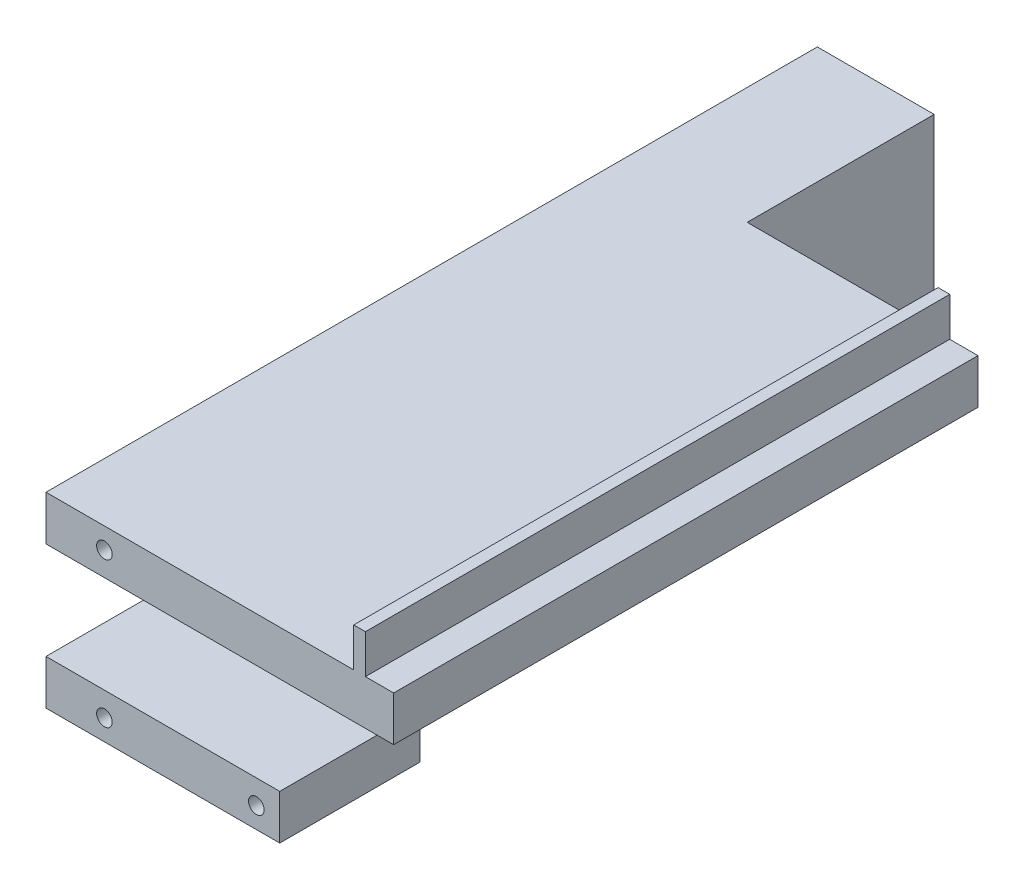
from build123d import *

# Parameters (mm, degrees)
CROQUIS1_W              = 60
CROQUIS1_H              = 48
SALIENTE_EXTRUIR1_DEPTH = 6
CROQUIS4_W              = 60
CROQUIS4_H              = 11.5
SALIENTE_EXTRUIR3_DEPTH = 30
CROQUIS5_R              = 2
CORTAR_EXTRUIR3_DEPTH   = 16
CROQUIS6_W              = 30
CROQUIS6_H              = 48
SALIENTE_EXTRUIR4_DEPTH = 162
CROQUIS7_R              = 2
CORTAR_EXTRUIR4_DEPTH   = 16
CROQUIS11_W             = 150
CROQUIS11_H             = 11.5
SALIENTE_EXTRUIR6_DEPTH = 59.25
CROQUIS12_W             = 3
CROQUIS12_H             = 150
SALIENTE_EXTRUIR7_DEPTH = 10


with BuildPart() as part:
    # Croquis1 → Saliente-Extruir1 (new body)
    with BuildSketch(Plane.XY):
        with Locations((-36.216216216, 7.011261261)):
            Rectangle(CROQUIS1_W, CROQUIS1_H)
    extrude(amount=SALIENTE_EXTRUIR1_DEPTH)

    # Croquis4 → Saliente-Extruir3 (add)
    with BuildSketch(Plane.XY.offset(6)):
        with Locations((-36.216216216, 25.261261261)):
            Rectangle(CROQUIS4_W, CROQUIS4_H)
        with Locations((-36.216216216, -11.238738739)):
            Rectangle(CROQUIS4_W, CROQUIS4_H)
    extrude(amount=SALIENTE_EXTRUIR3_DEPTH)

    # Croquis5 → Cortar-Extruir3 (cut)
    with BuildSketch(Plane.XY.offset(36)):
        with Locations((-51.216216216, 25.661261261)):
            Circle(CROQUIS5_R)
        with Locations((-12.216216216, 25.661261261)):
            Circle(CROQUIS5_R)
        with Locations((-12.216216216, -11.638738739)):
            Circle(CROQUIS5_R)
        with Locations((-51.216216216, -11.638738739)):
            Circle(CROQUIS5_R)
    extrude(amount=-CORTAR_EXTRUIR3_DEPTH, mode=Mode.SUBTRACT)

    # Croquis6 → Saliente-Extruir4 (add)
    with BuildSketch(Plane(origin=(0, 0, 0), x_dir=(-1, 0, 0), z_dir=(0, 0, -1))):
        with Locations((51.216216216, 7.011261261)):
            Rectangle(CROQUIS6_W, CROQUIS6_H)
    extrude(amount=SALIENTE_EXTRUIR4_DEPTH)

    # Croquis7 → Cortar-Extruir4 (cut)
    with BuildSketch(Plane(origin=(0, 0, -162), x_dir=(-1, 0, 0), z_dir=(0, 0, -1))):
        with Locations((51.216216216, 7.011261261)):
            Circle(CROQUIS7_R)
    extrude(amount=-CORTAR_EXTRUIR4_DEPTH, mode=Mode.SUBTRACT)

    # Croquis11 → Saliente-Extruir6 (add)
    with BuildSketch(Plane(origin=(-36.216216216, 0, 0), x_dir=(0, 0, -1), z_dir=(1, 0, 0))):
        with Locations((39, 25.261261261)):
            Rectangle(CROQUIS11_W, CROQUIS11_H)
    extrude(amount=SALIENTE_EXTRUIR6_DEPTH)

    # Croquis12 → Saliente-Extruir7 (add)
    with BuildSketch(Plane(origin=(0, 31.011261261, 0), x_dir=(1, 0, 0), z_dir=(0, 1, 0))):
        with Locations((14.283783784, 39)):
            Rectangle(CROQUIS12_W, CROQUIS12_H)
    extrude(amount=SALIENTE_EXTRUIR7_DEPTH)


solid = part.part
